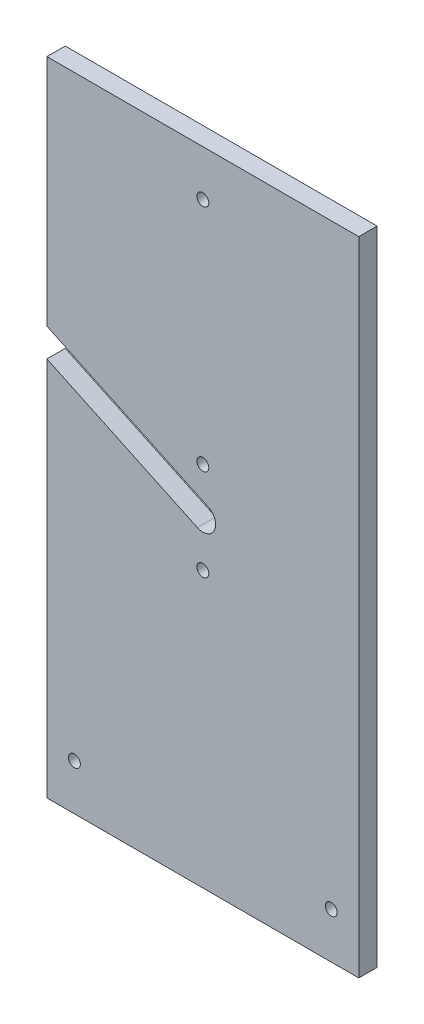
from build123d import *

# Parameters (mm, degrees)
AUFSATZ_LINEAR_AUSTRAGEN1_DEPTH  = 10
F_6_5_6_5_DURCHMESSER_BOHRUNG5_D = 6.5


with BuildPart() as part:
    # Skizze1 → Aufsatz-Linear austragen1 (new body)
    with BuildSketch(Plane.XY):
        with BuildLine():
            Line((85, 175), (-85, 175))
            Line((-85, 175), (-85, 47.736356447))
            Line((-85, 47.736356447), (2.980579254, 6.333730915))
            ThreePointArc((2.980579254, 6.333730915), (6.333730915, -2.980579254), (-2.980579254, -6.333730915))
            Line((-2.980579254, -6.333730915), (-85, 32.263643553))
            Line((-85, 32.263643553), (-85, -175))
            Line((-85, -175), (85, -175))
            Line((85, -175), (85, 175))
        make_face()
    extrude(amount=AUFSATZ_LINEAR_AUSTRAGEN1_DEPTH)

    # Ø6.5 (6.5) Durchmesser Bohrung5 (through all)
    with Locations(Plane.XY.offset(10)):
        with Locations((0, 150), (-70, -150), (70, -150), (0, 25), (0, -25)):
            Hole(F_6_5_6_5_DURCHMESSER_BOHRUNG5_D / 2)


solid = part.part
